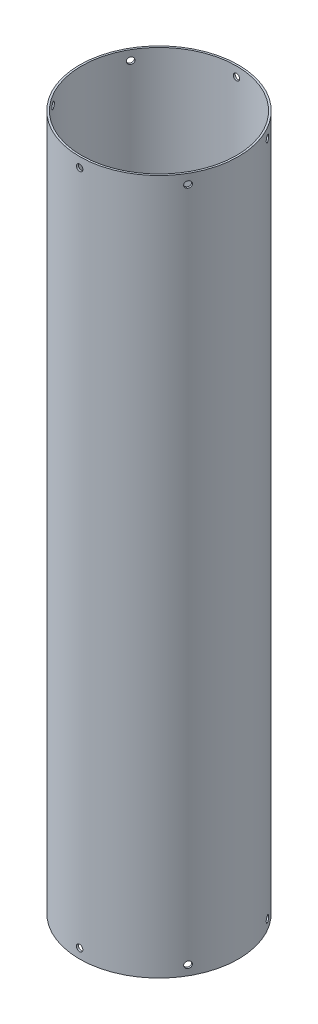
from build123d import *

# Parameters (mm, degrees)
SKETCH1_R                 = 78.359
SKETCH1_R_2               = 76.5175
INNER_OUTERDIAMETER_DEPTH = 685.8
SKETCH2_R                 = 3.175
TOP_BOTTOMBOLTHOLES_DEPTH = 695.695548972
CIRPATTERN1_COUNT         = 6


with BuildPart() as part:
    # Sketch1 → Inner&OuterDiameter (new body)
    with BuildSketch(Plane(origin=(0, 0, 0), x_dir=(1, 0, 0), z_dir=(0, 1, 0))):
        Circle(SKETCH1_R)
        Circle(SKETCH1_R_2, mode=Mode.SUBTRACT)
    extrude(amount=INNER_OUTERDIAMETER_DEPTH)

    # Sketch2 → Top&BottomBoltHoles (cut, through all)
    with BuildSketch(Plane.XY):
        with Locations((0, 676.275)):
            Circle(SKETCH2_R)
        with Locations((0, 9.525)):
            Circle(SKETCH2_R)
    top_bottomboltholes = extrude(amount=-TOP_BOTTOMBOLTHOLES_DEPTH, mode=Mode.SUBTRACT)

    # CirPattern1: Top&BottomBoltHoles ×6 about axis
    cirpattern1_axis = Axis((0, 685.8, 0), (0, -1, 0))
    for i in range(1, CIRPATTERN1_COUNT):
        add(top_bottomboltholes.rotate(cirpattern1_axis, i * 360 / CIRPATTERN1_COUNT), mode=Mode.SUBTRACT)


solid = part.part
